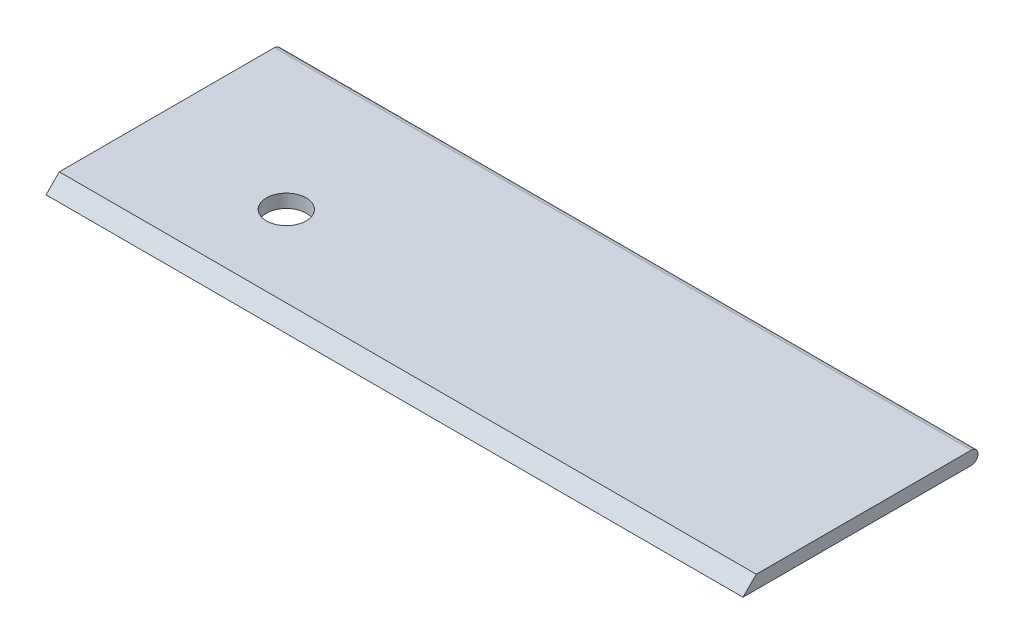
from build123d import *

# Parameters (mm, degrees)
SKETCH1_W           = 133.35
SKETCH1_H           = 44.958
BOSS_EXTRUDE1_DEPTH = 2.54
CUT_EXTRUDE1_DEPTH  = 141.747631824
SKETCH6_R           = 3.81
CUT_EXTRUDE3_DEPTH  = 141.747631824
SKETCH7_W           = 2.54
SKETCH7_H           = 5.08
BOSS_EXTRUDE2_DEPTH = 4.572
SKETCH9_R           = 0.762
CUT_EXTRUDE4_DEPTH  = 110.343091103
FILLET2_R           = 2.54
FILLET3_R           = 2.54
FILLET4_R           = 1.27
SKETCH16_R          = 1.4986
CUT_EXTRUDE8_DEPTH  = 2.032
SKETCH17_R          = 1.524
CUT_EXTRUDE9_DEPTH  = 2.032


with BuildPart() as part:
    # Sketch1 → Boss-Extrude1 (new body)
    with BuildSketch(Plane(origin=(0, 0, 0), x_dir=(1, 0, 0), z_dir=(0, 1, 0))):
        with Locations((66.675, -22.479)):
            Rectangle(SKETCH1_W, SKETCH1_H)
    extrude(amount=BOSS_EXTRUDE1_DEPTH)

    # Sketch2 → Cut-Extrude1 (cut, through all)
    with BuildSketch(Plane(origin=(133.35, 0, 0), x_dir=(0, 0, -1), z_dir=(1, 0, 0))):
        Polygon((-44.958, 0), (-44.958, 2.54), (-42.418, 2.54), align=None)
    extrude(amount=-CUT_EXTRUDE1_DEPTH, mode=Mode.SUBTRACT)

    # Sketch6 → Cut-Extrude3 (cut, through all)
    with BuildSketch(Plane(origin=(0, 2.54, 0), x_dir=(1, 0, 0), z_dir=(0, 1, 0))):
        with Locations(Location((27.94, -26.924, 0), (0, 0, 270))):
            Circle(SKETCH6_R)
    extrude(amount=-CUT_EXTRUDE3_DEPTH, mode=Mode.SUBTRACT)

    # Sketch7 → Boss-Extrude2 (add)
    with BuildSketch(Plane.XZ):
        with Locations((100.838, 25.4)):
            Rectangle(SKETCH7_W, SKETCH7_H)
    extrude(amount=BOSS_EXTRUDE2_DEPTH)

    # Sketch9 → Cut-Extrude4 (cut, through all)
    with BuildSketch(Plane.ZY.offset(-99.568)):
        with Locations((25.4, -2.286)):
            Circle(SKETCH9_R)
    extrude(amount=-CUT_EXTRUDE4_DEPTH, mode=Mode.SUBTRACT)

    # Fillet2
    fillet2_edges = [part.edges().sort_by_distance(p)[0] for p in [
        (100.838, -4.572, 27.94),
    ]]
    fillet(fillet2_edges, radius=FILLET2_R)

    # Fillet3
    fillet3_edges = [part.edges().sort_by_distance(p)[0] for p in [
        (100.838, -4.572, 22.86),
    ]]
    fillet(fillet3_edges, radius=FILLET3_R - 0.0001)  # a hair under: the kernel refuses the full size

    # Fillet4
    fillet4_edges = [part.edges().sort_by_distance(p)[0] for p in [
        (66.675, 0, 0),
        (66.675, 2.54, 0),
    ]]
    fillet(fillet4_edges, radius=FILLET4_R - 0.0001)  # a hair under: the kernel refuses the full size

    # Sketch16 → Cut-Extrude8 (cut)
    with BuildSketch(Plane.XZ):
        with Locations(Location((20.955, 5.9436, 0), (0, 0, 270))):
            Circle(SKETCH16_R)
        with Locations(Location((30.9626, 5.9436, 0), (0, 0, 270))):
            Circle(SKETCH16_R)
        with Locations(Location((102.3874, 5.9436, 0), (0, 0, 270))):
            Circle(SKETCH16_R)
        with Locations(Location((112.395, 5.9436, 0), (0, 0, 270))):
            Circle(SKETCH16_R)
    extrude(amount=-CUT_EXTRUDE8_DEPTH, mode=Mode.SUBTRACT)

    # Sketch17 → Cut-Extrude9 (cut)
    with BuildSketch(Plane(origin=(0, 0, 0), x_dir=(1, 0, 0), z_dir=(0, 1, 0))):
        with Locations(Location((38.1, -16.764, 0), (0, 0, 270))):
            Circle(SKETCH17_R)
        with Locations(Location((17.78, -16.764, 0), (0, 0, 270))):
            Circle(SKETCH17_R)
    extrude(amount=CUT_EXTRUDE9_DEPTH, mode=Mode.SUBTRACT)


solid = part.part
